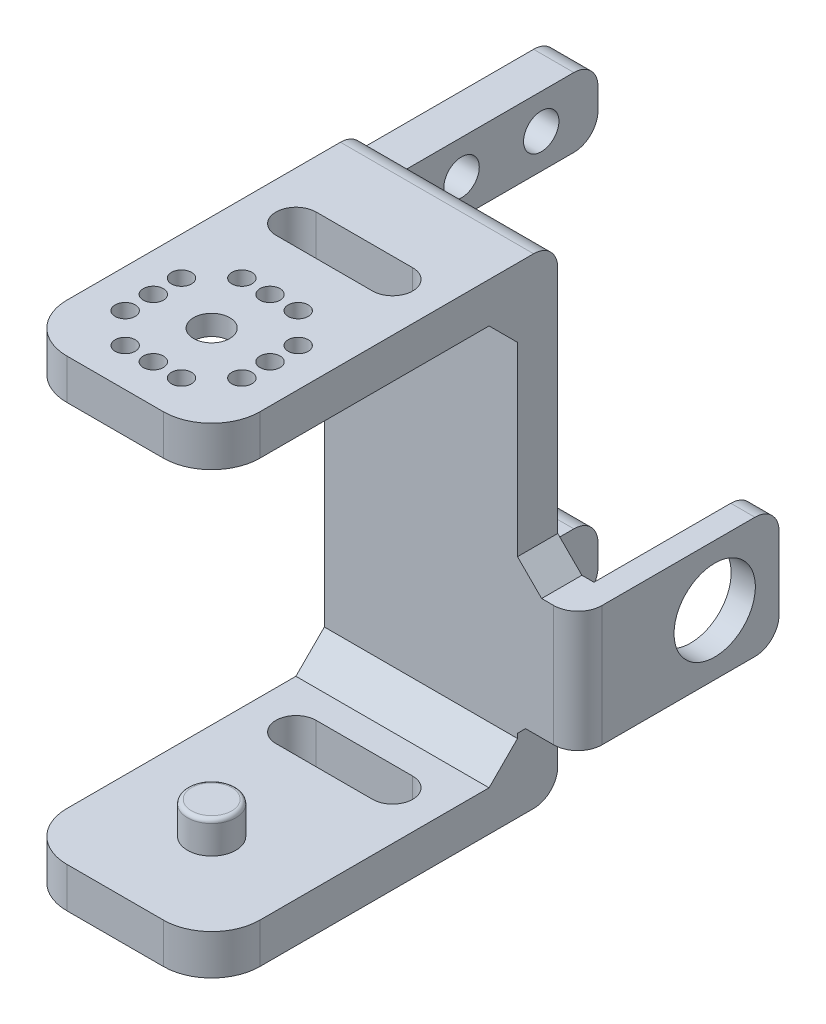
from build123d import *

# Parameters (mm, degrees)
BOSS_EXTRUDE1_DEPTH = 24
SKETCH2_R           = 10.5
CUT_EXTRUDE1_DEPTH  = 2.5
SKETCH4_R           = 2.25
SKETCH4_R_2         = 1.25
CUT_EXTRUDE2_DEPTH  = 10
SKETCH11_R          = 3
BOSS_EXTRUDE2_DEPTH = 4
CUT_EXTRUDE5_DEPTH  = 65
SKETCH13_W          = 24
SKETCH13_H          = 8.6
SKETCH13_R          = 2.2
BOSS_EXTRUDE3_DEPTH = 5
SKETCH14_W          = 5
SKETCH14_H          = 15
BOSS_EXTRUDE4_DEPTH = 7.5
SKETCH15_W          = 3
SKETCH15_H          = 15
BOSS_EXTRUDE5_DEPTH = 20
SKETCH16_R          = 5.05
CUT_EXTRUDE6_DEPTH  = 79.900823823
CHAMFER1_SIZE       = 3
CHAMFER2_SIZE       = 1
FILLET2_R           = 6
FILLET7_R           = 3
FILLET8_R           = 0.5


with BuildPart() as part:
    # Sketch1 → Boss-Extrude1 (new body)
    with BuildSketch(Plane(origin=(0, 0, 0), x_dir=(0, 0, -1), z_dir=(1, 0, 0))):
        Polygon((0, 59.7), (0, 0), (-43, 0), (-43, 5), (-8.535533906, 5), (-5, 8.535533906), (-5, 51.164466094), (-8.535533906, 54.7), (-43, 54.7), (-43, 59.7), align=None)
    extrude(amount=BOSS_EXTRUDE1_DEPTH)

    # Sketch2 → Cut-Extrude1 (cut)
    with BuildSketch(Plane.XZ.offset(-54.7)):
        with Locations(Location((12, 31, 0), (0, 0, 270))):
            Circle(SKETCH2_R)
    extrude(amount=-CUT_EXTRUDE1_DEPTH, mode=Mode.SUBTRACT)

    # Sketch4 → Cut-Extrude2 (cut)
    with BuildSketch(Plane.XZ.offset(-57.2)):
        with Locations(Location((12, 31, 0), (0, 0, 270))):
            Circle(SKETCH4_R)
        with Locations(Location((12, 38.25, 0), (0, 0, 270))):
            Circle(SKETCH4_R_2)
        with Locations(Location((8.5, 38.25, 0), (0, 0, 270))):
            Circle(SKETCH4_R_2)
        with Locations(Location((15.5, 38.25, 0), (0, 0, 270))):
            Circle(SKETCH4_R_2)
        with Locations(Location((19.25, 34.5, 0), (0, 0, 270))):
            Circle(SKETCH4_R_2)
        with Locations(Location((19.25, 31, 0), (0, 0, 270))):
            Circle(SKETCH4_R_2)
        with Locations(Location((19.25, 27.5, 0), (0, 0, 270))):
            Circle(SKETCH4_R_2)
        with Locations(Location((15.5, 23.75, 0), (0, 0, 270))):
            Circle(SKETCH4_R_2)
        with Locations(Location((12, 23.75, 0), (0, 0, 270))):
            Circle(SKETCH4_R_2)
        with Locations(Location((8.5, 23.75, 0), (0, 0, 270))):
            Circle(SKETCH4_R_2)
        with Locations(Location((4.75, 27.5, 0), (0, 0, 270))):
            Circle(SKETCH4_R_2)
        with Locations(Location((4.75, 31, 0), (0, 0, 270))):
            Circle(SKETCH4_R_2)
        with Locations(Location((4.75, 34.5, 0), (0, 0, 270))):
            Circle(SKETCH4_R_2)
    extrude(amount=-CUT_EXTRUDE2_DEPTH, mode=Mode.SUBTRACT)

    # Sketch11 → Boss-Extrude2 (add)
    with BuildSketch(Plane(origin=(0, 5, 0), x_dir=(1, 0, 0), z_dir=(0, 1, 0))):
        with Locations(Location((12, -31, 0), (0, 0, 90))):
            Circle(SKETCH11_R)
    extrude(amount=BOSS_EXTRUDE2_DEPTH)

    # Sketch12 → Cut-Extrude5 (cut, symmetric)
    with BuildSketch(Plane.XZ.offset(-54.7)):
        with BuildLine():
            Line((6, 12.017766953), (18, 12.017766953))
            ThreePointArc((18, 12.017766953), (20.5, 14.517766953), (18, 17.017766953))
            Line((18, 17.017766953), (6, 17.017766953))
            ThreePointArc((6, 17.017766953), (3.5, 14.517766953), (6, 12.017766953))
        make_face()
    extrude(amount=CUT_EXTRUDE5_DEPTH, both=True, mode=Mode.SUBTRACT)

    # Sketch13 → Boss-Extrude3 (add)
    # profile 1 of 2: a face of its own
    with BuildSketch(Plane.ZY):
        with Locations((-12, 4.3)):
            Rectangle(SKETCH13_W, SKETCH13_H)
        with Locations((-16.95, 4.3)):
            Circle(SKETCH13_R, mode=Mode.SUBTRACT)
        with Locations((-7.05, 4.3)):
            Circle(SKETCH13_R, mode=Mode.SUBTRACT)
    # profile 2 of 2: a face of its own
    with BuildSketch(Plane.ZY):
        with Locations((-12, 53.4)):
            Rectangle(SKETCH13_W, SKETCH13_H)
        with Locations(Location((-16.95, 53.4, 0), (0, 0, 180))):
            Circle(SKETCH13_R, mode=Mode.SUBTRACT)
        with Locations(Location((-7.05, 53.4, 0), (0, 0, 180))):
            Circle(SKETCH13_R, mode=Mode.SUBTRACT)
    extrude(amount=-BOSS_EXTRUDE3_DEPTH)

    # Sketch14 → Boss-Extrude4 (add)
    with BuildSketch(Plane(origin=(24, 0, 0), x_dir=(0, 0, -1), z_dir=(1, 0, 0))):
        with Locations((-2.5, 17.6)):
            Rectangle(SKETCH14_W, SKETCH14_H)
    extrude(amount=BOSS_EXTRUDE4_DEPTH)

    # Sketch15 → Boss-Extrude5 (add)
    with BuildSketch(Plane(origin=(0, 0, 0), x_dir=(-1, 0, 0), z_dir=(0, 0, -1))):
        with Locations((-30, 17.6)):
            Rectangle(SKETCH15_W, SKETCH15_H)
    extrude(amount=BOSS_EXTRUDE5_DEPTH)

    # Sketch16 → Cut-Extrude6 (cut, through all)
    with BuildSketch(Plane.ZY.offset(-28.5)):
        with Locations((-12, 17.6)):
            Circle(SKETCH16_R)
    extrude(amount=-CUT_EXTRUDE6_DEPTH, mode=Mode.SUBTRACT)

    # Chamfer1
    chamfer1_edges = [part.edges().sort_by_distance(p)[0] for p in [
        (24, 25.1, 2.5),
    ]]
    chamfer(chamfer1_edges, length=CHAMFER1_SIZE)

    # Chamfer2
    chamfer2_edges = [part.edges().sort_by_distance(p)[0] for p in [
        (24, 10.1, 2.5),
    ]]
    chamfer(chamfer2_edges, length=CHAMFER2_SIZE)

    # Fillet2
    fillet2_edges = [part.edges().sort_by_distance(p)[0] for p in [
        (0, 2.5, 43),
        (0, 57.2, 43),
        (24, 2.5, 43),
        (24, 57.2, 43),
    ]]
    fillet(fillet2_edges, radius=FILLET2_R)

    # Fillet7
    # the kernel refuses this fillet: 3 mm, written as the material it takes off along each edge
    with BuildSketch(Plane(origin=(-7.5, 59.7, 0), x_dir=(0, -1, 0), z_dir=(1, 0, 0))) as fillet7_piece_1_section:
        with BuildLine():
            CenterArc((FILLET7_R, -FILLET7_R), FILLET7_R, 90, 90)
            Line((0, -FILLET7_R), (0, 0))
            Line((0, 0), (FILLET7_R, 0))
        make_face()
    fillet7_piece_1 = extrude(amount=39, mode=Mode.PRIVATE)
    fillet7_piece_1 = split(fillet7_piece_1, bisect_by=Plane(origin=(2.5, 57.7, 0.688760919), z_dir=(0, 1, 0)), keep=Keep.TOP, mode=Mode.PRIVATE)
    add(fillet7_piece_1, mode=Mode.SUBTRACT)
    with BuildSketch(Plane(origin=(-7.5, 59.7, 0), x_dir=(0, -1, 0), z_dir=(1, 0, 0))) as fillet7_piece_2_section:
        with BuildLine():
            CenterArc((FILLET7_R, -FILLET7_R), FILLET7_R, 90, 90)
            Line((0, -FILLET7_R), (0, 0))
            Line((0, 0), (FILLET7_R, 0))
        make_face()
    fillet7_piece_2 = extrude(amount=39, mode=Mode.PRIVATE)
    fillet7_piece_2 = split(fillet7_piece_2, bisect_by=Plane(origin=(5, 57.451452112, 0.051209323), z_dir=(1, 0, 0)), keep=Keep.TOP, mode=Mode.PRIVATE)
    add(fillet7_piece_2, mode=Mode.SUBTRACT)
    with BuildSketch(Plane(origin=(-7.5, 0, -24), x_dir=(0, 0, 1), z_dir=(1, 0, 0)), Plane(origin=(-7.5, 8.6, -24), x_dir=(0, -1, 0), z_dir=(1, 0, 0)), Plane(origin=(-7.5, 49.1, -24), x_dir=(0, 0, 1), z_dir=(1, 0, 0))) as fillet7_piece_3:
        with BuildLine():
            CenterArc((FILLET7_R, -FILLET7_R), FILLET7_R, 90, 90)
            Line((0, -FILLET7_R), (0, 0))
            Line((0, 0), (FILLET7_R, 0))
        make_face()
    extrude(amount=20, mode=Mode.SUBTRACT)
    with BuildSketch(Plane(origin=(-7.5, 57.7, -24), x_dir=(0, 0, 1), z_dir=(1, 0, 0))) as fillet7_piece_4:
        with BuildLine():
            CenterArc((FILLET7_R, FILLET7_R), FILLET7_R, 180, 90)
            Line((0, FILLET7_R), (0, 0))
            Line((0, 0), (FILLET7_R, 0))
        make_face()
    extrude(amount=20, mode=Mode.SUBTRACT)
    with BuildSketch(Plane(origin=(31.5, 32.6, 5), x_dir=(-1, 0, 0), z_dir=(0, -1, 0))) as fillet7_piece_5:
        with BuildLine():
            CenterArc((FILLET7_R, FILLET7_R), FILLET7_R, 180, 90)
            Line((0, FILLET7_R), (0, 0))
            Line((0, 0), (FILLET7_R, 0))
        make_face()
    extrude(amount=30, mode=Mode.SUBTRACT)
    with BuildSketch(Plane(origin=(21, 10.1, -20), x_dir=(0, 0, 1), z_dir=(1, 0, 0)), Plane(origin=(39, 25.1, -20), x_dir=(0, 0, 1), z_dir=(-1, 0, 0))) as fillet7_piece_6:
        with BuildLine():
            CenterArc((FILLET7_R, -FILLET7_R), FILLET7_R, 90, 90)
            Line((0, -FILLET7_R), (0, 0))
            Line((0, 0), (FILLET7_R, 0))
        make_face()
    extrude(amount=18, mode=Mode.SUBTRACT)
    with BuildSketch(Plane(origin=(5, 0, 0), x_dir=(0, 0, 1), z_dir=(1, 0, 0))) as fillet7_piece_7:
        with BuildLine():
            CenterArc((FILLET7_R, -FILLET7_R), FILLET7_R, 90, 90)
            Line((0, -FILLET7_R), (0, 0))
            Line((0, 0), (FILLET7_R, 0))
        make_face()
    extrude(amount=26.5, mode=Mode.SUBTRACT)

    # Fillet8
    fillet8_edges = [part.edges().sort_by_distance(p)[0] for p in [
        (12, 9, 34),
    ]]
    fillet(fillet8_edges, radius=FILLET8_R)


solid = part.part
